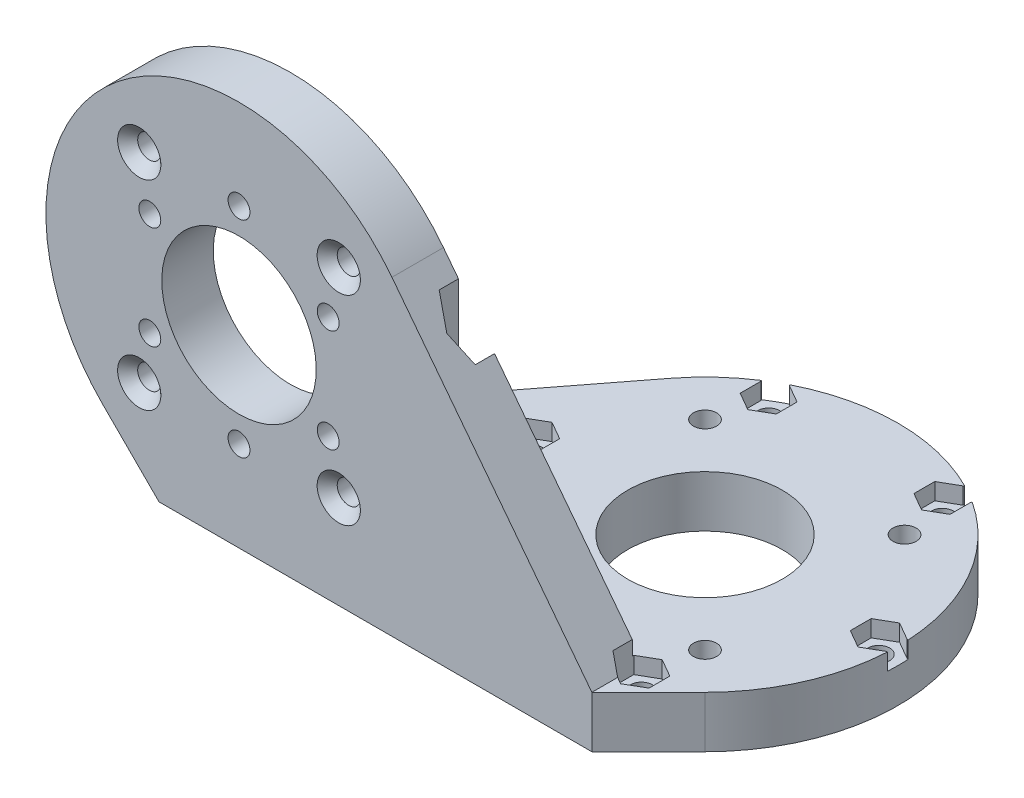
from build123d import *

# Parameters (mm, degrees)
BOSS_EXTRUDE1_DEPTH   = 8
CIRPATTERN1_COUNT     = 2
SKETCH3_R             = 12
CUT_EXTRUDE1_DEPTH    = 95.051900566
CUT_EXTRUDE2_START    = -2.6
CUT_EXTRUDE2_DEPTH    = 97.651900566
M3_CLEARANCE_HOLE1_D  = 3.4
CIRPATTERN2_COUNT     = 6
CIRPATTERN3_START     = 22
CIRPATTERN3_OUTLINE_R = 12
CIRPATTERN3_DEPTH     = 8
CUT_EXTRUDE3_DEPTH    = 3.6
M3_CLEARANCE_HOLE2_D  = 3.4
CIRPATTERN4_COUNT     = 6
SKETCH15_W            = 0.975112204
SKETCH15_H            = 3.233161508
CUT_EXTRUDE4_DEPTH    = 2.6
CIRPATTERN5_COUNT     = 3
CIRPATTERN5_ANGLE     = 120


# Read off the part's stored shape, not the designer's step: CSK for M3 Hex Socket Countersunk Cap Screw1, CirPattern3
with BuildPart() as part:
    # Sketch1 → Boss-Extrude1 (new body)
    with BuildSketch(Plane(origin=(0, 0, 0), x_dir=(1, 0, 0), z_dir=(0, 1, 0))):
        with BuildLine():
            Line((21.213203436, -21.213203436), (12.426406871, -30))
            Line((12.426406871, -30), (-54.826406871, -30))
            Line((-54.826406871, -30), (-54.826406871, -22))
            Line((-54.826406871, -22), (-23.763220436, 18.311454189))
            ThreePointArc((-23.763220436, 18.311454189), (19.803416038, 22.534966457), (21.213203436, -21.213203436))
        make_face()
    boss_extrude1 = extrude(amount=BOSS_EXTRUDE1_DEPTH)

    # CirPattern1: Boss-Extrude1 ×2 about axis
    cirpattern1_axis = Axis((-21.2, 15, 15), (0, 0.7071067811865476, -0.7071067811865476))
    for i in range(1, CIRPATTERN1_COUNT):
        add(boss_extrude1.rotate(cirpattern1_axis, i * 360 / CIRPATTERN1_COUNT))

    # Sketch3 → Cut-Extrude1 (cut, through all)
    with BuildSketch(Plane(origin=(0, 8, 0), x_dir=(1, 0, 0), z_dir=(0, 1, 0))):
        with Locations(Location((0, 0, 0), (0, 0, 270))):
            Circle(SKETCH3_R)
    extrude(amount=-CUT_EXTRUDE1_DEPTH, mode=Mode.SUBTRACT)

    # Sketch4 → Cut-Extrude2 (cut)
    with BuildSketch(Plane(origin=(0, 8, 0), x_dir=(1, 0, 0), z_dir=(0, 1, 0)).offset(CUT_EXTRUDE2_START)):
        Polygon((27, 3.233161507), (24.2, 1.616580754), (24.2, -1.616580754), (27, -3.233161507), (29.8, -1.616580754), (29.8, 1.616580754), align=None)
    cut_extrude2 = extrude(amount=CUT_EXTRUDE2_DEPTH, mode=Mode.SUBTRACT)

    # M3 Clearance Hole1 (through all)
    with Locations(Plane(origin=(0, 5.4, 0), x_dir=(1, 0, 0), z_dir=(0, 1, 0))):
        with Locations((27, 0)):
            m3_clearance_hole1 = Hole(M3_CLEARANCE_HOLE1_D / 2)

    # CirPattern2: Cut-Extrude2, M3 Clearance Hole1 ×6 about axis
    cirpattern2_axis = Axis((0, 0, 0), (0, 1, 0))
    add([cut_extrude2.rotate(cirpattern2_axis, i * 360 / CIRPATTERN2_COUNT) for i in range(1, CIRPATTERN2_COUNT)], mode=Mode.SUBTRACT)
    add([m3_clearance_hole1.rotate(cirpattern2_axis, i * 360 / CIRPATTERN2_COUNT) for i in range(1, CIRPATTERN2_COUNT)], mode=Mode.SUBTRACT)

    # CSK for M3 Hex Socket Countersunk Ca 2 → CSK for M3 Hex Socket Countersunk Cap Screw1 (revolve, cut)
    with BuildSketch(Plane(origin=(-15.5, 0, -15.5), x_dir=(1, 0, 0), z_dir=(0, 0, 1))):
        Polygon((1.8, 1.56), (1.8, 8), (0, 8), (0, 0), (3.36, 0), align=None)
    revolve(axis=Axis((-15.5, 0, -15.5), (0, 1, 0)), mode=Mode.SUBTRACT)

    # CSK for M3 Hex Socket Countersunk Ca 3 o → CSK for M3 Hex Socket Countersunk Ca 3 (revolve, cut)
    with BuildSketch(Plane(origin=(15.5, 0, 15.5), x_dir=(1, 0, 0), z_dir=(0, 0, 1))):
        Polygon((1.8, 1.56), (1.8, 8), (0, 8), (0, 0), (3.36, 0), align=None)
    revolve(axis=Axis((15.5, 0, 15.5), (0, 1, 0)), mode=Mode.SUBTRACT)

    # CSK for M3 Hex Socket Countersunk Ca 4 o → CSK for M3 Hex Socket Countersunk Ca 4 (revolve, cut)
    with BuildSketch(Plane(origin=(-15.5, 0, 15.5), x_dir=(1, 0, 0), z_dir=(0, 0, 1))):
        Polygon((1.8, 1.56), (1.8, 8), (0, 8), (0, 0), (3.36, 0), align=None)
    revolve(axis=Axis((-15.5, 0, 15.5), (0, 1, 0)), mode=Mode.SUBTRACT)

    # CSK for M3 Hex Socket Countersunk Ca 5 o → CSK for M3 Hex Socket Countersunk Ca 5 (revolve, cut)
    with BuildSketch(Plane(origin=(15.5, 0, -15.5), x_dir=(1, 0, 0), z_dir=(0, 0, 1))):
        Polygon((1.8, 1.56), (1.8, 8), (0, 8), (0, 0), (3.36, 0), align=None)
    revolve(axis=Axis((15.5, 0, -15.5), (0, 1, 0)), mode=Mode.SUBTRACT)

    # CirPattern3 outline → CirPattern3 (cut)
    with BuildSketch(Plane.XY.offset(CIRPATTERN3_START)):
        with Locations((-42.4, 30)):
            Circle(CIRPATTERN3_OUTLINE_R)
    extrude(amount=CIRPATTERN3_DEPTH, mode=Mode.SUBTRACT)

    # CirPattern3 2 outline → CirPattern3 2 (revolve, cut)
    with BuildSketch(Plane(origin=(-26.9, 45.5, 0), x_dir=(1, 0, 0), z_dir=(0, -1, 0))):
        Polygon((0, 22), (1.8, 22), (1.8, 28.44), (3.36, 30), (0, 30), align=None)
    revolve(axis=Axis((-26.9, 45.5, 0), (0, 0, 1)), mode=Mode.SUBTRACT)

    # CirPattern3 3 outline → CirPattern3 3 (revolve, cut)
    with BuildSketch(Plane(origin=(-57.9, 14.5, 0), x_dir=(1, 0, 0), z_dir=(0, -1, 0))):
        Polygon((0, 22), (1.8, 22), (1.8, 28.44), (3.36, 30), (0, 30), align=None)
    revolve(axis=Axis((-57.9, 14.5, 0), (0, 0, 1)), mode=Mode.SUBTRACT)

    # CirPattern3 4 outline → CirPattern3 4 (revolve, cut)
    with BuildSketch(Plane(origin=(-26.9, 14.5, 0), x_dir=(1, 0, 0), z_dir=(0, -1, 0))):
        Polygon((0, 22), (1.8, 22), (1.8, 28.44), (3.36, 30), (0, 30), align=None)
    revolve(axis=Axis((-26.9, 14.5, 0), (0, 0, 1)), mode=Mode.SUBTRACT)

    # CirPattern3 5 outline → CirPattern3 5 (revolve, cut)
    with BuildSketch(Plane(origin=(-57.9, 45.5, 0), x_dir=(1, 0, 0), z_dir=(0, -1, 0))):
        Polygon((0, 22), (1.8, 22), (1.8, 28.44), (3.36, 30), (0, 30), align=None)
    revolve(axis=Axis((-57.9, 45.5, 0), (0, 0, 1)), mode=Mode.SUBTRACT)

    # Sketch11 → Cut-Extrude3 (cut)
    with BuildSketch(Plane(origin=(0, 0, 22), x_dir=(-1, 0, 0), z_dir=(0, 0, -1))):
        Polygon((45.633161507, 46), (44.016580754, 48.8), (40.783419246, 48.8), (39.166838493, 46), (40.783419246, 43.2), (44.016580754, 43.2), align=None)
    cut_extrude3 = extrude(amount=-CUT_EXTRUDE3_DEPTH, mode=Mode.SUBTRACT)

    # M3 Clearance Hole2 (through all)
    with Locations(Plane(origin=(0, 0, 25.6), x_dir=(-1, 0, 0), z_dir=(0, 0, -1))):
        with Locations((42.4, 46)):
            m3_clearance_hole2 = Hole(M3_CLEARANCE_HOLE2_D / 2)

    # CirPattern4: Cut-Extrude3, M3 Clearance Hole2 ×6 about axis
    cirpattern4_axis = Axis((-42.4, 30, 0), (0, 0, 1))
    add([cut_extrude3.rotate(cirpattern4_axis, i * 360 / CIRPATTERN4_COUNT) for i in range(1, CIRPATTERN4_COUNT)], mode=Mode.SUBTRACT)
    add([m3_clearance_hole2.rotate(cirpattern4_axis, i * 360 / CIRPATTERN4_COUNT) for i in range(1, CIRPATTERN4_COUNT)], mode=Mode.SUBTRACT)

    # Sketch15 → Cut-Extrude4 (cut)
    with BuildSketch(Plane(origin=(0, 8, 0), x_dir=(1, 0, 0), z_dir=(0, 1, 0))):
        with Locations((30.287556102, 0)):
            Rectangle(SKETCH15_W, SKETCH15_H)
    cut_extrude4 = extrude(amount=-CUT_EXTRUDE4_DEPTH, mode=Mode.SUBTRACT)

    # CirPattern5: Cut-Extrude4 ×3 about axis
    cirpattern5_axis = Axis((0, 0, 0), (0, 1, 0))
    for i in range(1, CIRPATTERN5_COUNT):
        add(cut_extrude4.rotate(cirpattern5_axis, i * CIRPATTERN5_ANGLE / (CIRPATTERN5_COUNT - 1)), mode=Mode.SUBTRACT)


solid = part.part
